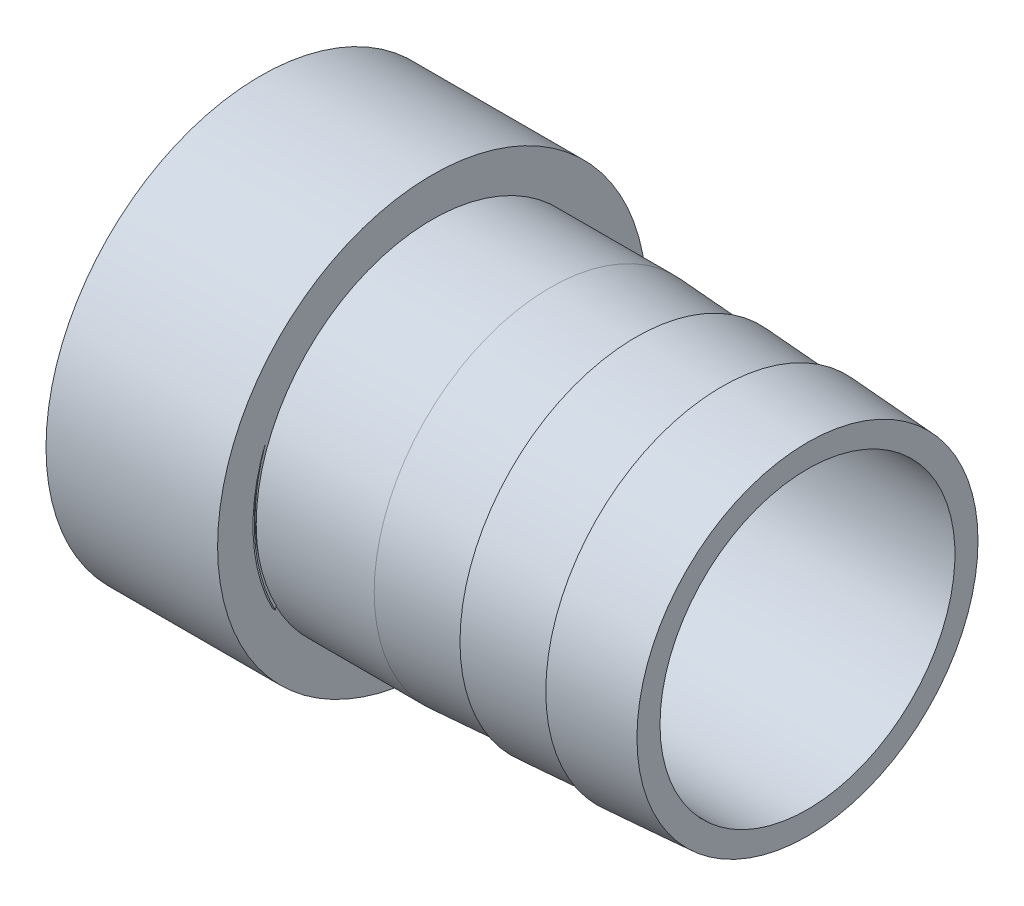
from build123d import *

# Parameters (mm, degrees)
GWINT1_PITCH = 1.953846154


with BuildPart() as part:
    # Szkic1 → Obrót1 (revolve)
    with BuildSketch(Plane.XY, mode=Mode.PRIVATE) as obr_t1_sk:
        Polygon((0, 16.4), (11, 16.4), (19, 15.9), (19, 16.4), (27, 15.9), (27, 16.4), (35, 15.9), (35, 13.75), (-1.2, 13.75), (-1.2, 16.7), (-16, 16.7), (-16, 20), (0, 20), align=None)
    revolve(obr_t1_sk.sketch.rotate(Axis((0, 0, 0), (1, 0, 0)), 90), axis=Axis((0, 0, 0), (1, 0, 0)))

    # Gwint1: the profile of Profil gwintu1 profile screwed along a right-hand helix of 7.574803 turns, 10 arcs to a turn; built about Z, then put on its axis
    gwint1_z = Axis((0, 0, 0), (0, 0, 1))
    gwint1_corners = [(16.7003, 0, -0.000173205), (15.642449752, 0, 0.61057692), (15.642449752, 0, 0.85480769), (16.7003, 0, 1.465557815)]
    with BuildLine(mode=Mode.PRIVATE) as gwint1_profile:
        Line(gwint1_corners[0], gwint1_corners[1])
        Line(gwint1_corners[1], gwint1_corners[2])
        Line(gwint1_corners[2], gwint1_corners[3])
        Line(gwint1_corners[3], gwint1_corners[0])
    gwint1_cap = Face(gwint1_profile.wire())
    gwint1_turn_angles = [0, 18, 36, 54, 72, 90, 108, 126, 144, 162, 180, 198, 216, 234, 252, 270, 288, 306, 324, 342, 360]
    gwint1_turn_weights = [1, 0.9510565162951535, 1, 0.9510565162951535, 1, 0.9510565162951535, 1, 0.9510565162951535, 1, 0.9510565162951535, 1, 0.9510565162951535, 1, 0.9510565162951535, 1, 0.9510565162951535, 1, 0.9510565162951535, 1, 0.9510565162951535, 1]
    gwint1_turn_rails = [Edge.make_bspline([Vector(p[0], p[1], 0).rotate(gwint1_z, gwint1_turn_angles[k]) / gwint1_turn_weights[k] + Vector(0, 0, p[2] + GWINT1_PITCH * gwint1_turn_angles[k] / 360) for k in range(21)], [0, 0, 0, 1, 1, 2, 2, 3, 3, 4, 4, 5, 5, 6, 6, 7, 7, 8, 8, 9, 9, 10, 10, 10], 2, gwint1_turn_weights) for p in gwint1_corners]
    gwint1_turn_sides = [Face.make_surface_from_curves(gwint1_turn_rails[p[0]], gwint1_turn_rails[p[1]]) for p in [(0, 1), (1, 2), (2, 3), (3, 0)]]
    gwint1_last_angles = [2520, 2538, 2556, 2574, 2592, 2610, 2628, 2646, 2664, 2682, 2700, 2713.464566929, 2726.929133858]
    gwint1_last_weights = [1, 0.9510565162951535, 1, 0.9510565162951535, 1, 0.9510565162951535, 1, 0.9510565162951535, 1, 0.9510565162951535, 1, 0.9725141026055483, 1]
    gwint1_last_rails = [Edge.make_bspline([Vector(p[0], p[1], 0).rotate(gwint1_z, gwint1_last_angles[k]) / gwint1_last_weights[k] + Vector(0, 0, p[2] + GWINT1_PITCH * gwint1_last_angles[k] / 360) for k in range(13)], [0, 0, 0, 1, 1, 2, 2, 3, 3, 4, 4, 5, 5, 6, 6, 6], 2, gwint1_last_weights) for p in gwint1_corners]
    gwint1_last_sides = [Face.make_surface_from_curves(gwint1_last_rails[p[0]], gwint1_last_rails[p[1]]) for p in [(0, 1), (1, 2), (2, 3), (3, 0)]]
    gwint1 = Plane(origin=(-16, 0, 0), x_dir=(0, 0, -1), z_dir=(1, 0, 0)) * Solid(Shell([*[p.moved(Location((0, 0, GWINT1_PITCH * i))) for i in range(7) for p in gwint1_turn_sides], *gwint1_last_sides, gwint1_cap, gwint1_cap.rotate(gwint1_z, 2726.929133858).moved(Location((0, 0, GWINT1_PITCH * 2726.929133858 / 360)))]))
    add(gwint1)


solid = part.part
